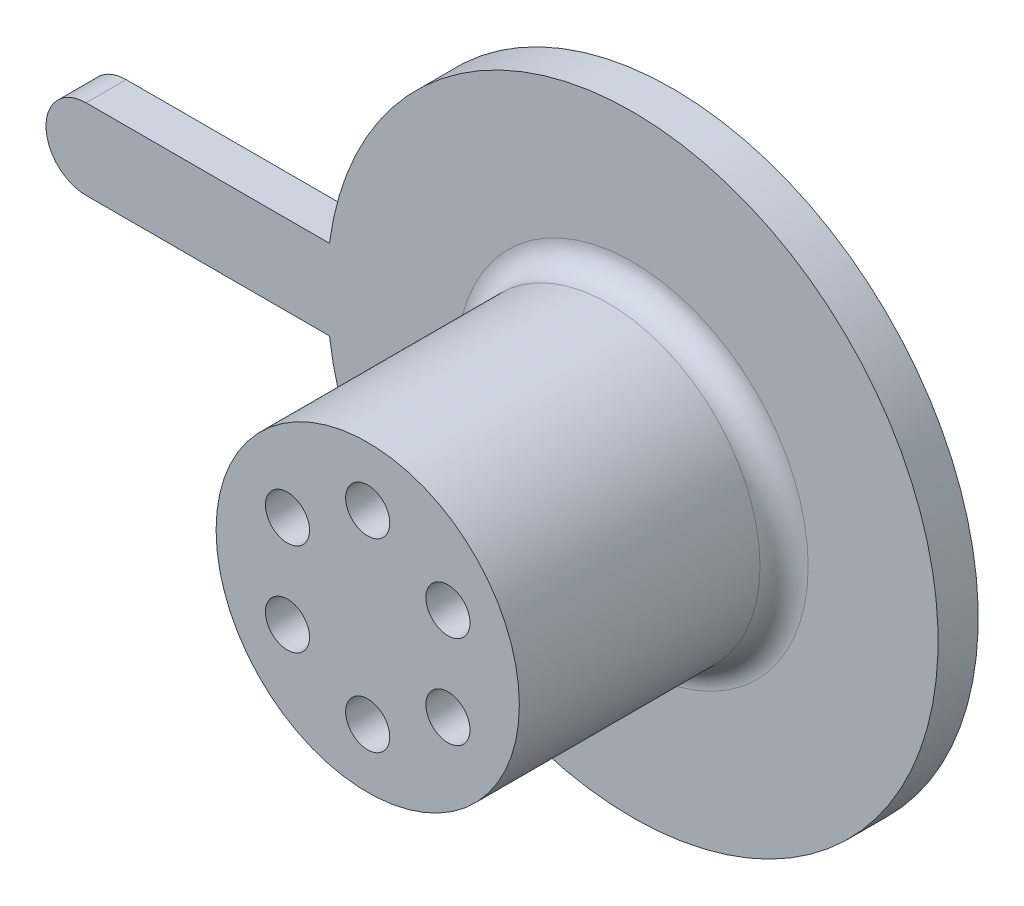
from build123d import *

# Parameters (mm, degrees)
BOSS_EXTRUDE3_DEPTH = 5
SKETCH5_R           = 18.9
BOSS_EXTRUDE4_DEPTH = 33
FILLET4_R           = 3
SKETCH6_R           = 2.75
CUT_EXTRUDE4_DEPTH  = 39.48


with BuildPart() as part:
    # Sketch4 → Boss-Extrude3 (new body)
    with BuildSketch(Plane.XY):
        with BuildLine():
            Line((-68.1, -5), (-37.770491127, -5))
            ThreePointArc((-37.770491127, -5), (38.1, 0), (-37.770491127, 5))
            Line((-37.770491127, 5), (-68.1, 5))
            ThreePointArc((-68.1, 5), (-73.1, 0), (-68.1, -5))
        make_face()
    extrude(amount=BOSS_EXTRUDE3_DEPTH)

    # Sketch5 → Boss-Extrude4 (add)
    with BuildSketch(Plane.XY.offset(5)):
        Circle(SKETCH5_R)
    extrude(amount=BOSS_EXTRUDE4_DEPTH)

    # Fillet4
    fillet4_edges = [part.edges().sort_by_distance(p)[0] for p in [
        (-18.9, 0, 5),
    ]]
    fillet(fillet4_edges, radius=FILLET4_R)

    # Sketch6 → Cut-Extrude4 (cut)
    with BuildSketch(Plane.XY.offset(38)):
        with Locations((0, 11.547005384)):
            Circle(SKETCH6_R)
        with Locations((-10, 5.773502692)):
            Circle(SKETCH6_R)
        with Locations((10, 5.773502692)):
            Circle(SKETCH6_R)
        with Locations((-10, -5.773502692)):
            Circle(SKETCH6_R)
        with Locations((10, -5.773502692)):
            Circle(SKETCH6_R)
        with Locations((0, -11.547005384)):
            Circle(SKETCH6_R)
    extrude(amount=-CUT_EXTRUDE4_DEPTH, mode=Mode.SUBTRACT)


solid = part.part
